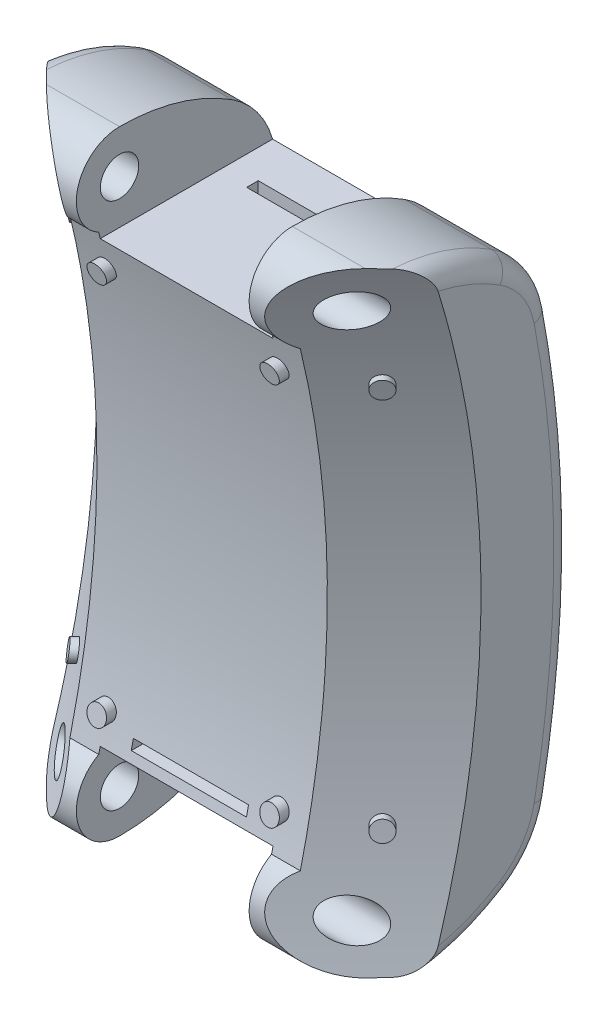
from build123d import *

# Parameters (mm, degrees)
CROQUIS3_R                    = 2
BASE_PIEZA_DEPTH              = 20
CHEPA_DEPTH                   = 20
CROQUIS6_W                    = 32.047750913
CROQUIS6_H                    = 16.912599977
CORTE_SUPERIOR_INFERIOR_DEPTH = 9
CROQUIS18_W                   = 1.2
CROQUIS18_H                   = 4.790082328
RANURA_INFERIOR_DEPTH         = 6
SALIENTES_CHAFL_N_REACH       = 44.886
CROQUIS11_R                   = 1
CROQUIS10_R                   = 1
SALIENTES_DEPTH               = 3.43
ALISAR_SALIENTES_DEPTH        = 42.63297571
RANURA_START                  = -0.1
CROQUIS9_W                    = 6
CROQUIS9_H                    = 1
RANURA_SUPERIOR_DEPTH         = 42.73297571
CROQUIS9_2_W                  = 6
CROQUIS9_2_H                  = 1
CROQUIS17_W                   = 12
CROQUIS17_H                   = 37.8
ALIGERAR_DEPTH                = 14.5
CROQUIS22_W                   = 6
CROQUIS22_H                   = 1
CORTAR_EXTRUIR1_DEPTH         = 10
REDONDEO_POSTERIOR_R          = 2
REDONDEO1_R                   = 1


with BuildPart() as part:
    # Croquis3 → Base pieza (new body)
    with BuildSketch(Plane(origin=(0, 0, 0), x_dir=(0, 0, -1), z_dir=(1, 0, 0))):
        with BuildLine():
            ThreePointArc((-2.813805957, -23.555120195), (-3.441085434, -31.028778071), (3.688282778, -28.700441654))
            ThreePointArc((3.688282778, -28.700441654), (7.587059336, 0), (3.688282778, 28.700441654))
            ThreePointArc((3.688282778, 28.700441654), (-3.441085434, 31.028778071), (-2.813805957, 23.555120195))
            ThreePointArc((-2.813805957, 23.555120195), (0, 0), (-2.813805957, -23.555120195))
        make_face()
        with Locations((-0.648644687, 27.5)):
            Circle(CROQUIS3_R, mode=Mode.SUBTRACT)
        with Locations((-0.648644687, -27.5)):
            Circle(CROQUIS3_R, mode=Mode.SUBTRACT)
    base_pieza = extrude(amount=BASE_PIEZA_DEPTH)

    # Croquis8 → Chepa (add)
    with BuildSketch(Plane(origin=(0, 0, 0), x_dir=(0, 0, -1), z_dir=(1, 0, 0))):
        with BuildLine():
            ThreePointArc((15.506521591, -22.021807219), (17.587059336, 0), (15.506521591, 22.021807219))
            ThreePointArc((15.506521591, 22.021807219), (13.963829758, 25.755729781), (11.069609295, 28.574517411))
            ThreePointArc((11.069609295, 28.574517411), (5.455685894, 31.12607714), (-0.648644687, 32))
            ThreePointArc((-0.648644687, 32), (2.076058284, 31.081339655), (3.688282778, 28.700441654))
            ThreePointArc((3.688282778, 28.700441654), (7.587059336, 0), (3.688282778, -28.700441654))
            ThreePointArc((3.688282778, -28.700441654), (2.076058284, -31.081339655), (-0.648644687, -32))
            ThreePointArc((-0.648644687, -32), (5.455685894, -31.12607714), (11.069609295, -28.574517411))
            ThreePointArc((11.069609295, -28.574517411), (13.963829758, -25.755729781), (15.506521591, -22.021807219))
        make_face()
    chepa = extrude(amount=CHEPA_DEPTH)

    # Chaflán: sweep along a path in Croquis4
    with BuildLine(Plane(origin=(0, 0, 0), x_dir=(1, 0, 0), z_dir=(0, 1, 0))) as chafl_n_path:
        Line((20, 8.06866908), (4.928932188, -7.002398732))
    # Croquis5 → Chaflán (sweep, cut)
    with BuildSketch(Plane(origin=(20, 0, 0), x_dir=(0, 0, -1), z_dir=(1, 0, 0))):
        with BuildLine():
            Line((-7.893329885, 38.940484337), (0.307091226, 38.462981025))
            ThreePointArc((0.307091226, 38.462981025), (8, 0), (0.307091226, -38.462981025))
            Line((0.307091226, -38.462981025), (-7.893329885, -38.940484337))
            ThreePointArc((-7.893329885, -38.940484337), (-6.101689444, -34.39632647), (-4.534084232, -29.770101218))
            ThreePointArc((-4.534084232, -29.770101218), (-4.985572152, -26.299558346), (-2.813805957, -23.555120195))
            ThreePointArc((-2.813805957, -23.555120195), (0, 0), (-2.813805957, 23.555120195))
            ThreePointArc((-2.813805957, 23.555120195), (-4.985572152, 26.299558346), (-4.534084232, 29.770101218))
            ThreePointArc((-4.534084232, 29.770101218), (-6.101689444, 34.39632647), (-7.893329885, 38.940484337))
        make_face()
    chafl_n = sweep(path=chafl_n_path.line, mode=Mode.SUBTRACT)

    # Croquis6 → Corte superior/inferior (cut)
    with BuildSketch(Plane.ZY):
        with Locations((-1.716480389, 31.356299989)):
            Rectangle(CROQUIS6_W, CROQUIS6_H)
        with Locations((-1.716480389, -31.356299989)):
            Rectangle(CROQUIS6_W, CROQUIS6_H)
    corte_superior_inferior = extrude(amount=-CORTE_SUPERIOR_INFERIOR_DEPTH, mode=Mode.SUBTRACT)

    # Croquis18 → Ranura inferior (cut)
    with BuildSketch(Plane.ZY):
        with Locations((-10.197613279, 20.504958836)):
            Rectangle(CROQUIS18_W, CROQUIS18_H)
    ranura_inferior = extrude(amount=-RANURA_INFERIOR_DEPTH, mode=Mode.SUBTRACT)

    # Croquis11 → Salientes chaflán (add, up to next)
    with BuildSketch(Plane(origin=(8.581915545, 0, 8.581915545), x_dir=(0, 1, 0), z_dir=(0.7071067811865488, -3.540403830777016e-14, 0.7071067811865464)), mode=Mode.PRIVATE) as salientes_chafl_n_sk1:
        with Locations(Location((19.9, -12.542408938, 0), (0, 0, 270))):
            Circle(CROQUIS11_R)
    salientes_chafl_n_tool1 = extrude(salientes_chafl_n_sk1.sketch, amount=-SALIENTES_CHAFL_N_REACH, mode=Mode.PRIVATE) - part.part
    # Croquis11 → Salientes chaflán (add, up to next)
    with BuildSketch(Plane(origin=(8.581915545, 0, 8.581915545), x_dir=(0, 1, 0), z_dir=(0.7071067811865488, -3.540403830777016e-14, 0.7071067811865464)), mode=Mode.PRIVATE) as salientes_chafl_n_sk2:
        with Locations(Location((-19.9, -12.542408938, 0), (0, 0, 270))):
            Circle(CROQUIS11_R)
    salientes_chafl_n_tool2 = extrude(salientes_chafl_n_sk2.sketch, amount=-SALIENTES_CHAFL_N_REACH, mode=Mode.PRIVATE) - part.part
    salientes_chafl_n_1 = salientes_chafl_n_tool1.solids().sort_by_distance((17.450738, 19.9, -0.286907))[0]
    add(salientes_chafl_n_1)
    salientes_chafl_n_2 = salientes_chafl_n_tool2.solids().sort_by_distance((17.450738, -19.9, -0.286907))[0]
    add(salientes_chafl_n_2)
    salientes_chafl_n = salientes_chafl_n_1 + salientes_chafl_n_2  # Salientes chaflán as one shape, for the pattern or mirror that repeats it

    # Croquis10 → Salientes (add)
    with BuildSketch(Plane.XY):
        with Locations(Location((9, 19.9, 0), (0, 0, 180))):
            Circle(CROQUIS10_R)
        with Locations(Location((9, -19.9, 0), (0, 0, 180))):
            Circle(CROQUIS10_R)
    salientes = extrude(amount=SALIENTES_DEPTH)

    # Alisar salientes laterales: sweep along a path in Croquis4<3>
    with BuildLine(Plane(origin=(0, 0, 0), x_dir=(1, 0, 0), z_dir=(0, 1, 0))) as alisar_salientes_laterales_path:
        Line((20, 8.06866908), (4.928932188, -7.002398732))
    # Croquis14 → Alisar salientes laterales (sweep, cut)
    with BuildSketch(Plane(origin=(20, 0, 0), x_dir=(0, 0, -1), z_dir=(1, 0, 0))):
        with BuildLine():
            Line((-2.832847965, -43.242163381), (-15.736791571, -43.242163381))
            Line((-15.736791571, -43.242163381), (-15.736791571, 39.497939725))
            Line((-15.736791571, 39.497939725), (-1.131002196, 39.497939725))
            ThreePointArc((-1.131002196, 39.497939725), (6.978853402, -2.056422246), (-2.832847965, -43.242163381))
        make_face()
    alisar_salientes_laterales = sweep(path=alisar_salientes_laterales_path.line, mode=Mode.SUBTRACT)

    # Croquis16 → Alisar salientes (cut, symmetric)
    with BuildSketch(Plane(origin=(0, 0, 0), x_dir=(0, 0, -1), z_dir=(1, 0, 0))):
        with BuildLine():
            Line((-3.652306709, -22.762293327), (-3.747951245, 23.163400234))
            ThreePointArc((-3.747951245, 23.163400234), (-1.00021469, 0.206176277), (-3.652306709, -22.762293327))
        make_face()
    alisar_salientes = extrude(amount=ALISAR_SALIENTES_DEPTH, both=True, mode=Mode.SUBTRACT)

    # Croquis9 → Ranura superior (cut)
    with BuildSketch(Plane.XY.offset(RANURA_START)):
        with Locations((3, -21.4)):
            Rectangle(CROQUIS9_W, CROQUIS9_H)
    ranura_superior = extrude(amount=RANURA_SUPERIOR_DEPTH, mode=Mode.SUBTRACT)

    # Ranura superior v2: sweep along a path in Croquis21
    with BuildLine(Plane(origin=(0, 0, 0), x_dir=(0, 0, -1), z_dir=(1, 0, 0))) as ranura_superior_v2_path:
        ThreePointArc((-0.485865363, -23.337017554), (6.897149642, -20.589637603), (10, -13.348827785))
    # Croquis9<2> → Ranura superior v2 (sweep, cut)
    with BuildSketch(Plane.XY):
        with Locations((3, -21.4)):
            Rectangle(CROQUIS9_2_W, CROQUIS9_2_H)
    ranura_superior_v2 = sweep(path=ranura_superior_v2_path.line, mode=Mode.SUBTRACT)

    # Croquis17 → Aligerar (cut)
    with BuildSketch(Plane.ZY):
        with Locations((-11.587059336, 1)):
            Rectangle(CROQUIS17_W, CROQUIS17_H)
    aligerar = extrude(amount=-ALIGERAR_DEPTH, mode=Mode.SUBTRACT)

    # Croquis22 → Cortar-Extruir1 (cut)
    with BuildSketch(Plane(origin=(0, -17.9, 0), x_dir=(1, 0, 0), z_dir=(0, 1, 0))):
        with Locations((3, 8.739432141)):
            Rectangle(CROQUIS22_W, CROQUIS22_H)
    cortar_extruir1 = extrude(amount=-CORTAR_EXTRUIR1_DEPTH, mode=Mode.SUBTRACT)

    # Simetría1: Base pieza, Chepa, Chaflán, Corte superior/inferior, Ranura inferior, Salientes chaflán, Salientes, Alisar salientes laterales, Alisar salientes, Ranura superior, Ranura superior v2, Aligerar, Cortar-Extruir1 across plane
    add(base_pieza.mirror(Plane(origin=(0, 0, 0), x_dir=(0, 0, 1), z_dir=(1, 0, 0))))
    add(chepa.mirror(Plane(origin=(0, 0, 0), x_dir=(0, 0, 1), z_dir=(1, 0, 0))))
    add(chafl_n.mirror(Plane(origin=(0, 0, 0), x_dir=(0, 0, 1), z_dir=(1, 0, 0))), mode=Mode.SUBTRACT)
    add(corte_superior_inferior.mirror(Plane(origin=(0, 0, 0), x_dir=(0, 0, 1), z_dir=(1, 0, 0))), mode=Mode.SUBTRACT)
    add(ranura_inferior.mirror(Plane(origin=(0, 0, 0), x_dir=(0, 0, 1), z_dir=(1, 0, 0))), mode=Mode.SUBTRACT)
    add(salientes_chafl_n.mirror(Plane(origin=(0, 0, 0), x_dir=(0, 0, 1), z_dir=(1, 0, 0))))
    add(salientes.mirror(Plane(origin=(0, 0, 0), x_dir=(0, 0, 1), z_dir=(1, 0, 0))))
    add(alisar_salientes_laterales.mirror(Plane(origin=(0, 0, 0), x_dir=(0, 0, 1), z_dir=(1, 0, 0))), mode=Mode.SUBTRACT)
    add(alisar_salientes.mirror(Plane(origin=(0, 0, 0), x_dir=(0, 0, 1), z_dir=(1, 0, 0))), mode=Mode.SUBTRACT)
    add(ranura_superior.mirror(Plane(origin=(0, 0, 0), x_dir=(0, 0, 1), z_dir=(1, 0, 0))), mode=Mode.SUBTRACT)
    add(ranura_superior_v2.mirror(Plane(origin=(0, 0, 0), x_dir=(0, 0, 1), z_dir=(1, 0, 0))), mode=Mode.SUBTRACT)
    add(aligerar.mirror(Plane(origin=(0, 0, 0), x_dir=(0, 0, 1), z_dir=(1, 0, 0))), mode=Mode.SUBTRACT)
    add(cortar_extruir1.mirror(Plane(origin=(0, 0, 0), x_dir=(0, 0, 1), z_dir=(1, 0, 0))), mode=Mode.SUBTRACT)

    # Redondeo posterior
    redondeo_posterior_edges = [part.edges().sort_by_distance(p)[0] for p in [
        (20, -25.755729781, -13.963829758),
        (20, 0, -17.587059336),
        (20, 25.755729781, -13.963829758),
        (20, 30.568096098, -7.11379114),
        (-20, 30.568096098, -7.11379114),
        (-20, 25.755729781, -13.963829758),
        (-20, 0, -17.587059336),
        (-20, -25.755729781, -13.963829758),
        (-20, -30.568096098, -7.11379114),
        (20, -30.568096098, -7.11379114),
    ]]
    fillet(redondeo_posterior_edges, radius=REDONDEO_POSTERIOR_R)

    # Redondeo1
    # the kernel refuses this fillet: 1 mm, written as the material it adds along each edge
    with BuildSketch(Plane(origin=(-17, -17.9, -5.587059336), x_dir=(0, 0, -1), z_dir=(1, 0, 0))) as redondeo1_piece_1_section:
        with BuildLine():
            CenterArc((REDONDEO1_R, REDONDEO1_R), REDONDEO1_R, 180, 90)
            Line((0, REDONDEO1_R), (0, 0))
            Line((0, 0), (REDONDEO1_R, 0))
        make_face()
    redondeo1_piece_1 = extrude(amount=34, mode=Mode.PRIVATE)
    redondeo1_piece_1 = split(redondeo1_piece_1, bisect_by=Plane(origin=(-6, -17.9, -5.587059336), z_dir=(-1, 0, 0)), keep=Keep.TOP, mode=Mode.PRIVATE)
    add(redondeo1_piece_1)
    with BuildSketch(Plane(origin=(-17, -17.9, -5.587059336), x_dir=(0, 0, -1), z_dir=(1, 0, 0))) as redondeo1_piece_2_section:
        with BuildLine():
            CenterArc((REDONDEO1_R, REDONDEO1_R), REDONDEO1_R, 180, 90)
            Line((0, REDONDEO1_R), (0, 0))
            Line((0, 0), (REDONDEO1_R, 0))
        make_face()
    redondeo1_piece_2 = extrude(amount=34, mode=Mode.PRIVATE)
    redondeo1_piece_2 = redondeo1_piece_2 & Plane(origin=(-17, -13.348827785, 0), x_dir=(0, -0.9988189768386079, 0.04858653627371077), z_dir=(-1, 0, 0)) * Cylinder(7.551172215, 72, mode=Mode.PRIVATE)
    add(redondeo1_piece_2)
    with BuildSketch(Plane(origin=(-17, -17.9, -5.587059336), x_dir=(0, 0, -1), z_dir=(1, 0, 0))) as redondeo1_piece_3_section:
        with BuildLine():
            CenterArc((REDONDEO1_R, REDONDEO1_R), REDONDEO1_R, 180, 90)
            Line((0, REDONDEO1_R), (0, 0))
            Line((0, 0), (REDONDEO1_R, 0))
        make_face()
    redondeo1_piece_3 = extrude(amount=34, mode=Mode.PRIVATE)
    redondeo1_piece_3 = split(redondeo1_piece_3, bisect_by=Plane(origin=(6, -17.9, -5.587059336), z_dir=(1, 0, 0)), keep=Keep.TOP, mode=Mode.PRIVATE)
    add(redondeo1_piece_3)
    with BuildSketch(Plane(origin=(14.5, 22.4, -5.587059336), x_dir=(0, 0, -1), z_dir=(0, -1, 0))) as redondeo1_piece_4:
        with BuildLine():
            CenterArc((REDONDEO1_R, -REDONDEO1_R), REDONDEO1_R, 90, 90)
            Line((0, -REDONDEO1_R), (0, 0))
            Line((0, 0), (REDONDEO1_R, 0))
        make_face()
    extrude(amount=42.8)
    with BuildSketch(Plane(origin=(17, 19.9, -5.587059336), x_dir=(0, 0, -1), z_dir=(-1, 0, 0))) as redondeo1_piece_5:
        with BuildLine():
            CenterArc((REDONDEO1_R, REDONDEO1_R), REDONDEO1_R, 180, 90)
            Line((0, REDONDEO1_R), (0, 0))
            Line((0, 0), (REDONDEO1_R, 0))
        make_face()
    extrude(amount=34)
    with BuildSketch(Plane(origin=(-14.5, 22.4, -5.587059336), x_dir=(0, 0, -1), z_dir=(0, -1, 0))) as redondeo1_piece_6:
        with BuildLine():
            CenterArc((REDONDEO1_R, REDONDEO1_R), REDONDEO1_R, 180, 90)
            Line((0, REDONDEO1_R), (0, 0))
            Line((0, 0), (REDONDEO1_R, 0))
        make_face()
    extrude(amount=42.8)


solid = part.part
